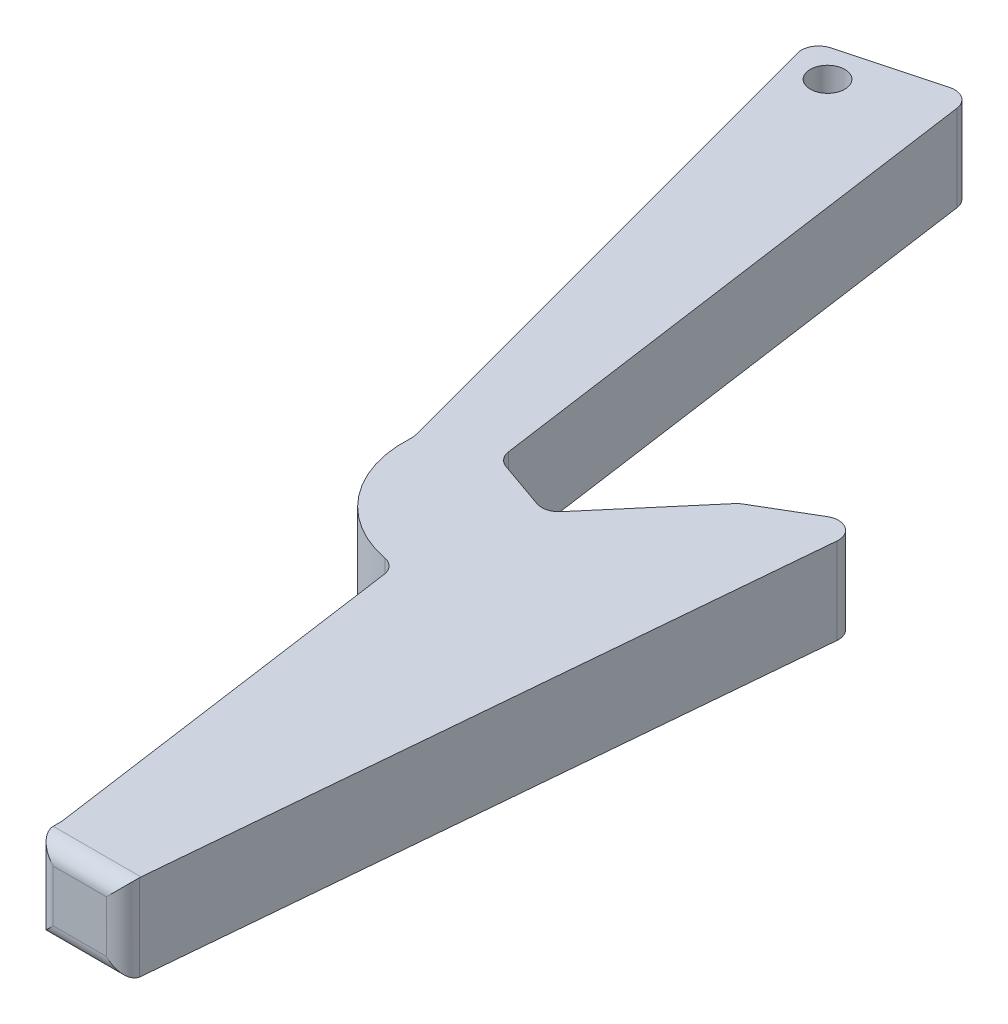
from build123d import *

# Parameters (mm, degrees)
BOSS_EXTRUDE1_DEPTH = 10
SKETCH3_R           = 2
CUT_EXTRUDE1_DEPTH  = 115.049114878
FILLET1_R           = 2
SCALE1_OUTLINE_R    = 2
SCALE1_DEPTH        = 10
SCALE1_START        = -121.994217108
SCALE1_2_OUTLINE_R  = 50.797559682
SCALE1_2_DEPTH      = 253.987798408
SCALE1_START_2      = 115
SCALE1_3_DEPTH      = 259.606010788


with BuildPart() as part:
    # Sketch2 → Boss-Extrude1 (new body)
    with BuildSketch(Plane(origin=(0, 0, 0), x_dir=(1, 0, 0), z_dir=(0, 1, 0))):
        with BuildLine():
            Line((-34.878175659, 26.752034212), (-49.878175659, 22.732796325))
            Line((-49.878175659, 22.732796325), (-33.054937728, -40.052382384))
            ThreePointArc((-33.054937728, -40.052382384), (-30.014485308, -49.526217776), (-21.165547534, -54.075306501))
            Line((-21.165547534, -54.075306501), (-14.841209972, -99.075306501))
            Line((-14.841209972, -99.075306501), (-14.841209972, -102.075306501))
            Line((-14.841209972, -102.075306501), (-4.841209972, -102.075306501))
            Line((-4.841209972, -102.075306501), (2.306162059, -22.075306501))
            Line((2.306162059, -22.075306501), (-7.517843313, -27.864196663))
            Line((-7.517843313, -27.864196663), (-17.883562238, -40.052382384))
            Line((-17.883562238, -40.052382384), (-25.883562238, -37.247965788))
            Line((-25.883562238, -37.247965788), (-34.878175659, 26.752034212))
        make_face()
    extrude(amount=BOSS_EXTRUDE1_DEPTH)

    # Sketch3 → Cut-Extrude1 (cut, through all)
    with BuildSketch(Plane(origin=(0, 10, 0), x_dir=(1, 0, 0), z_dir=(0, 1, 0))):
        with Locations(Location((-44.979196174, 19.9043692, 0), (0, 0, 270))):
            Circle(SKETCH3_R)
    extrude(amount=-CUT_EXTRUDE1_DEPTH, mode=Mode.SUBTRACT)

    # Fillet1
    fillet1_edges = [part.edges().sort_by_distance(p)[0] for p in [
        (-9.841209972, 0, 102.075306501),
        (-25.883562238, 5, 37.247965788),
        (-17.883562238, 5, 40.052382384),
        (-7.517843313, 5, 27.864196663),
        (2.306162059, 5, 22.075306501),
        (-4.841209972, 5, 102.075306501),
        (-14.841209972, 5, 102.075306501),
        (-21.165547534, 5, 54.075306501),
        (-33.054937728, 5, 40.052382384),
        (-49.878175659, 5, -22.732796325),
        (-34.878175659, 5, -26.752034212),
        (-9.841209972, 10, 102.075306501),
    ]]
    fillet(fillet1_edges, radius=FILLET1_R)

    # Scale1: read off the stored shape, not the designer's step
    # Scale1 outline → Scale1 (cut)
    with BuildSketch(Plane(origin=(0, 0, 0), x_dir=(1, 0, 0), z_dir=(0, 1, 0))):
        with BuildLine():
            Line((-49.360537569, 20.800944672), (-41.650784025, -7.972247266))
            Line((-41.650784025, -7.972247266), (-29.394150026, -12.26883574))
            Line((-29.394150026, -12.26883574), (-34.56356251, 24.513445333))
            ThreePointArc((-34.56356251, 24.513445333), (-35.440224677, 25.902870776), (-37.061736738, 26.166950784))
            Line((-37.061736738, 26.166950784), (-47.946324007, 23.250434415))
            ThreePointArc((-47.946324007, 23.250434415), (-49.160736724, 22.318582762), (-49.360537569, 20.800944672))
        make_face()
        with Locations((-44.979196174, 19.9043692)):
            Circle(SCALE1_OUTLINE_R, mode=Mode.SUBTRACT)
    extrude(amount=SCALE1_DEPTH, mode=Mode.SUBTRACT)

    # Scale1 2 outline → Scale1 2 (add)
    with BuildSketch(Plane(origin=(0, 0, 0), x_dir=(1, 0, 0), z_dir=(0, 1, 0)).offset(SCALE1_START)):
        with BuildLine():
            Line((-168.687755361, 65.685601537), (-384.843840888, 1603.716067804))
            ThreePointArc((-384.843840888, 1603.716067804), (-407.109990259, 1639.005778716), (-448.294418101, 1645.713088711))
            Line((-448.294418101, 1645.713088711), (-724.74965381, 1571.637131559))
            ThreePointArc((-724.74965381, 1571.637131559), (-755.594255054, 1547.969236591), (-760.668952729, 1509.42308086))
            Line((-760.668952729, 1509.42308086), (-348.726244774, -27.968035036))
            ThreePointArc((-348.726244774, -27.968035036), (-347.258373754, -35.952877877), (-347.081334171, -44.069590112))
            ThreePointArc((-347.081334171, -44.069590112), (-278.064712008, -266.014644418), (-79.909995387, -387.4955464))
            ThreePointArc((-79.909995387, -387.4955464), (-52.700625622, -402.378257255), (-39.215096586, -430.306475817))
            Line((-39.215096586, -430.306475817), (116.079849164, -1535.287430848))
            Line((116.079849164, -1535.287430848), (116.079849164, -1560.686210689))
            ThreePointArc((116.079849164, -1560.686210689), (130.958109927, -1596.605509607), (166.877408846, -1611.48377037))
            Line((166.877408846, -1611.48377037), (323.606120492, -1611.48377037))
            ThreePointArc((323.606120492, -1611.48377037), (357.890000816, -1598.169641955), (374.202152259, -1565.206568967))
            Line((374.202152259, -1565.206568967), (542.803771441, 321.938731014))
            ThreePointArc((542.803771441, 321.938731014), (519.350127439, 369.397217524), (466.419055413, 370.223639258))
            Line((466.419055413, 370.223639258), (309.451536343, 277.729010804))
            ThreePointArc((309.451536343, 277.729010804), (302.544435993, 272.840902782), (296.544589882, 266.874037447))
            Line((296.544589882, 266.874037447), (61.399717742, -9.613236968))
            ThreePointArc((61.399717742, -9.613236968), (35.980525842, -25.735570803), (5.899516763, -24.641103846))
            Line((5.899516763, -24.641103846), (-135.189124295, 24.817811952))
            ThreePointArc((-135.189124295, 24.817811952), (-157.670776916, 40.553007666), (-168.687755361, 65.685601537))
        make_face()
        with Locations((-649.388227221, 1486.651157832)):
            Circle(SCALE1_2_OUTLINE_R, mode=Mode.SUBTRACT)
    extrude(amount=SCALE1_2_DEPTH)

    # Scale1 3 outline → Scale1 3 (cut)
    with BuildSketch(Plane.YZ.offset(SCALE1_START_2)):
        with BuildLine():
            Line((131.9935813, 1611.48377037), (81.196021618, 1611.48377037))
            ThreePointArc((81.196021618, 1611.48377037), (117.115320537, 1596.605509607), (131.9935813, 1560.686210689))
            Line((131.9935813, 1560.686210689), (131.9935813, 1611.48377037))
        make_face()
        with BuildLine():
            ThreePointArc((-121.994217108, 1560.686210689), (-107.115956345, 1596.605509607), (-71.196657426, 1611.48377037))
            Line((-71.196657426, 1611.48377037), (-121.994217108, 1611.48377037))
            Line((-121.994217108, 1611.48377037), (-121.994217108, 1560.686210689))
        make_face()
    extrude(amount=SCALE1_3_DEPTH, mode=Mode.SUBTRACT)


solid = part.part
